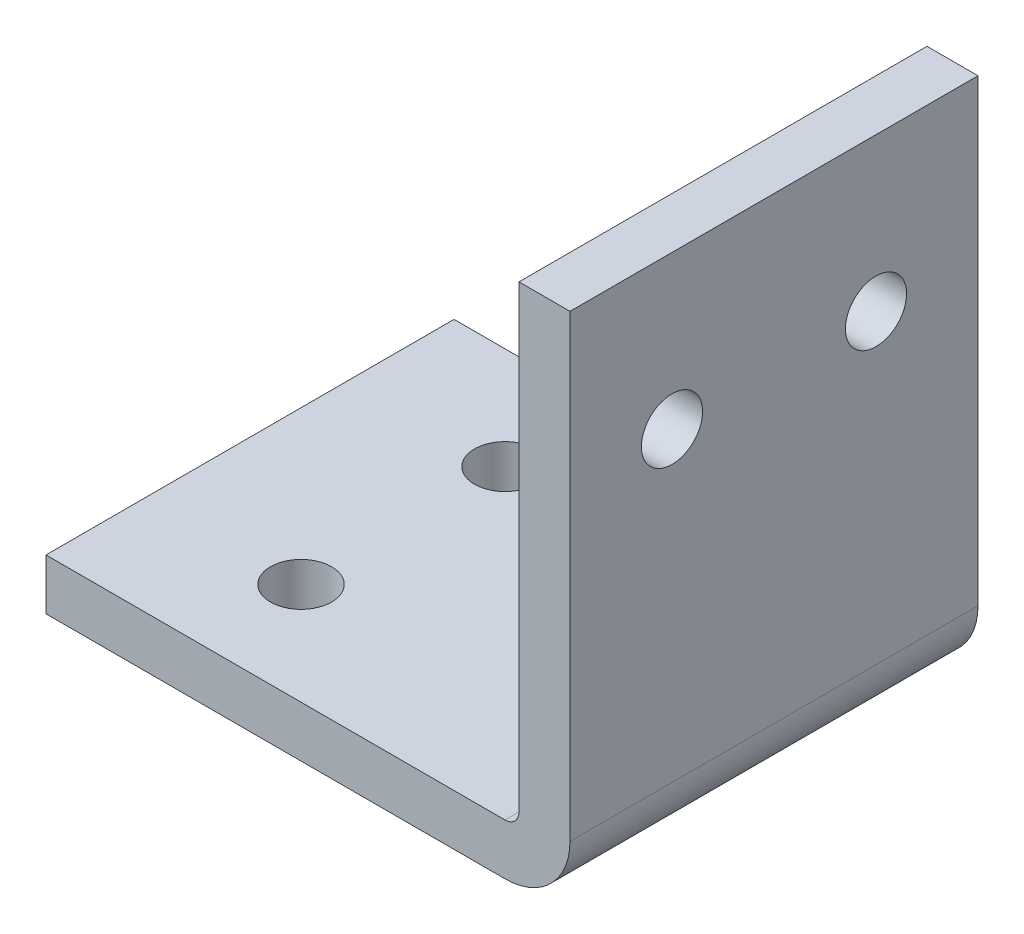
from build123d import *

# Parameters (mm, degrees)
SKETCH1_W           = 100
SKETCH1_H           = 40
BOSS_EXTRUDE2_DEPTH = 5
SKETCH4_R           = 3
CUT_EXTRUDE6_DEPTH  = 10
FLEX3_START         = 1.366197724
FLEX3_OUTLINE_W     = 5
FLEX3_OUTLINE_H     = 40
FLEX3_DEPTH         = 48.633802276
FLEX3_START_2       = -3.633802276
FLEX3_2_OUTLINE_W   = 46.366197724
FLEX3_2_OUTLINE_H   = 40
FLEX3_2_OUTLINE_R   = 3
FLEX3_2_DEPTH       = 3.907802276
FLEX3_START_3       = -5
FLEX3_3_OUTLINE_W   = 46.366197724
FLEX3_3_OUTLINE_H   = 40
FLEX3_3_OUTLINE_R   = 3
FLEX3_3_DEPTH       = 6.366197724
FLEX3_START_4       = -40
FLEX3_4_DEPTH       = 40
BOSS_EXTRUDE3_DEPTH = 1.5
CUT_EXTRUDE7_START  = -43
CUT_EXTRUDE7_DEPTH  = 43
BOSS_EXTRUDE4_DEPTH = 1.5
CUT_EXTRUDE8_DEPTH  = 40


with BuildPart() as part:
    # Sketch1 → Boss-Extrude2 (new body)
    with BuildSketch(Plane(origin=(0, 0, 0), x_dir=(1, 0, 0), z_dir=(0, 1, 0))):
        with Locations((0, 20)):
            Rectangle(SKETCH1_W, SKETCH1_H)
    extrude(amount=BOSS_EXTRUDE2_DEPTH)

    # Sketch4 → Cut-Extrude6 (cut)
    with BuildSketch(Plane(origin=(0, 5, 0), x_dir=(1, 0, 0), z_dir=(0, 1, 0))):
        with Locations(Location((-35, 30, 0), (0, 0, 270))):
            Circle(SKETCH4_R)
        with Locations(Location((-35, 10, 0), (0, 0, 270))):
            Circle(SKETCH4_R)
        with Locations(Location((35, 10, 0), (0, 0, 270))):
            Circle(SKETCH4_R)
        with Locations(Location((35, 30, 0), (0, 0, 270))):
            Circle(SKETCH4_R)
    extrude(amount=-CUT_EXTRUDE6_DEPTH, mode=Mode.SUBTRACT)

    # Flex3: read off the stored shape, not the designer's step
    # Flex3 outline → Flex3 (cut)
    with BuildSketch(Plane.YZ.offset(FLEX3_START)):
        with Locations((2.5, -20)):
            Rectangle(FLEX3_OUTLINE_W, FLEX3_OUTLINE_H)
    extrude(amount=FLEX3_DEPTH, mode=Mode.SUBTRACT)

    # Flex3 2 outline → Flex3 2 (add)
    with BuildSketch(Plane.YZ.offset(FLEX3_START_2)):
        with Locations((28.183098862, -20)):
            Rectangle(FLEX3_2_OUTLINE_W, FLEX3_2_OUTLINE_H)
        with Locations((36.366197724, -30)):
            Circle(FLEX3_2_OUTLINE_R, mode=Mode.SUBTRACT)
        with Locations((36.366197724, -10)):
            Circle(FLEX3_2_OUTLINE_R, mode=Mode.SUBTRACT)
    extrude(amount=FLEX3_2_DEPTH)

    # Flex3 3 outline → Flex3 3 (add)
    with BuildSketch(Plane.YZ.offset(FLEX3_START_3)):
        with Locations((28.183098862, -20)):
            Rectangle(FLEX3_3_OUTLINE_W, FLEX3_3_OUTLINE_H)
        with Locations((36.366197724, -30)):
            Circle(FLEX3_3_OUTLINE_R, mode=Mode.SUBTRACT)
        with Locations((36.366197724, -10)):
            Circle(FLEX3_3_OUTLINE_R, mode=Mode.SUBTRACT)
    extrude(amount=FLEX3_3_DEPTH)

    # Flex3 4 outline → Flex3 4 (cut)
    with BuildSketch(Plane.XY.offset(FLEX3_START_4)):
        with BuildLine():
            Line((1.366197724, 0), (1.366197724, 6.366197724))
            ThreePointArc((1.366197724, 6.366197724), (-0.498418419, 1.864616143), (-5, 0))
            Line((-5, 0), (1.366197724, 0))
        make_face()
        with BuildLine():
            ThreePointArc((-5, 5), (-4.033952325, 5.400150049), (-3.633802276, 6.366197724))
            Line((-3.633802276, 6.366197724), (-3.633802276, 51.366197724))
            Line((-3.633802276, 51.366197724), (-5, 51.366197724))
            Line((-5, 51.366197724), (-5, 5))
        make_face()
    extrude(amount=FLEX3_4_DEPTH, mode=Mode.SUBTRACT)

    # Sketch6 → Boss-Extrude3 (add, symmetric)
    with BuildSketch(Plane.XY.offset(-10)):
        Polygon((0, 0), (0, 15), (-15, 0), align=None)
    extrude(amount=BOSS_EXTRUDE3_DEPTH, both=True)

    # Sketch7 → Cut-Extrude7 (cut)
    with BuildSketch(Plane.XY.offset(CUT_EXTRUDE7_START)):
        with BuildLine():
            Line((-5, 0), (0, 0))
            Line((0, 0), (0, 2.425579313))
            ThreePointArc((0, 2.425579313), (-2.221356671, 0.638404544), (-5, 0))
        make_face()
    extrude(amount=CUT_EXTRUDE7_DEPTH, mode=Mode.SUBTRACT)

    # Sketch9 → Boss-Extrude4 (add, symmetric)
    with BuildSketch(Plane.XY.offset(-30)):
        Polygon((0, 0), (0, 15), (-15, 0), align=None)
    extrude(amount=BOSS_EXTRUDE4_DEPTH, both=True)

    # Sketch10 → Cut-Extrude8 (cut)
    with BuildSketch(Plane(origin=(0, 0, -40), x_dir=(-1, 0, 0), z_dir=(0, 0, -1))):
        with BuildLine():
            Line((0, 2.425579313), (0, 0))
            Line((0, 0), (5, 0))
            ThreePointArc((5, 0), (2.221356671, 0.638404544), (0, 2.425579313))
        make_face()
    extrude(amount=-CUT_EXTRUDE8_DEPTH, mode=Mode.SUBTRACT)


solid = part.part
